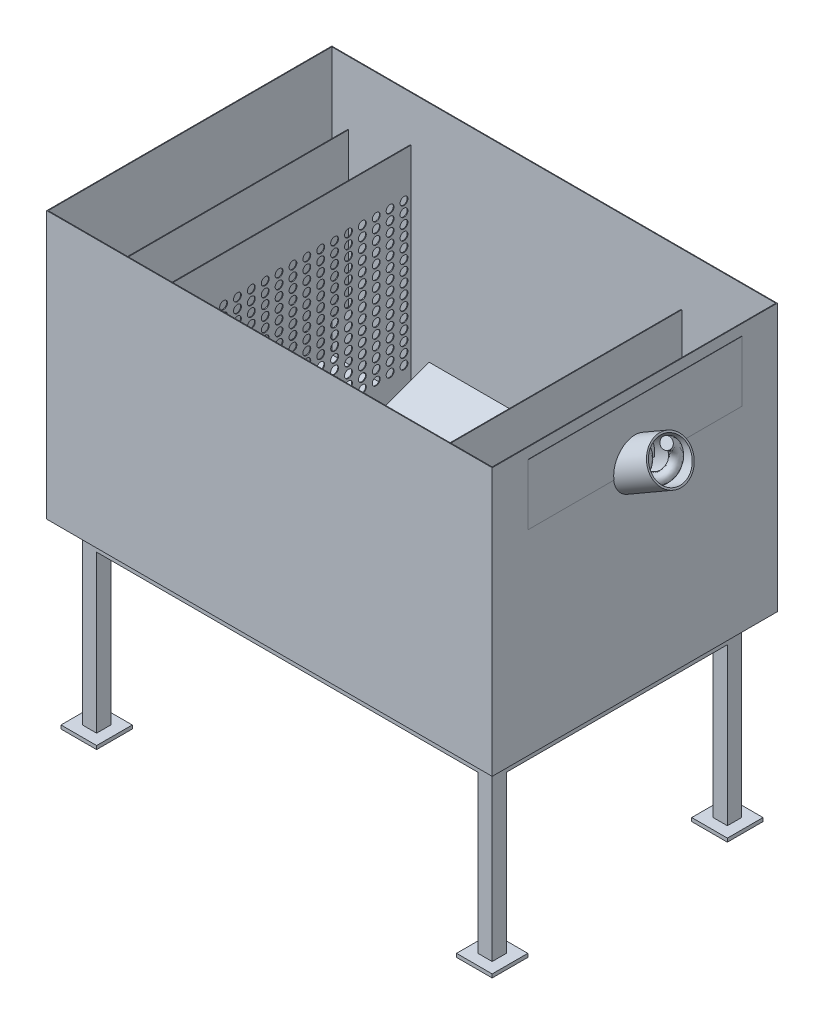
from build123d import *

# Parameters (mm, degrees)
MASTER_FOOTPRINT_W                       = 1250
MASTER_FOOTPRINT_H                       = 800.0000000000001
BATH_BASE_PLATE_DEPTH                    = 750
BATH_SHELL_2MM_T                         = -2
SKETCH_1_R                               = 50.00000000000001
INLET_D100_OPENING_DEPTH                 = 10
INLET_IMPACT_BAFFLE_START                = 125
SKETCH_2_W                               = 640.0000000000001
SKETCH_2_H                               = 430
INLET_IMPACT_BAFFLE_DEPTH                = 2
DISTRIBUTOR_D22_START                    = 250
SKETCH_3_W                               = 740
SKETCH_3_H                               = 648
SKETCH_3_R                               = 11.000000000000004
SKETCH_3_R_2                             = 10.999999999999996
SKETCH_3_R_3                             = 11.00000000000001
DISTRIBUTOR_D22_DEPTH                    = 2
OUTLET_SUBMERGED_BAFFLE_START            = 1030
SKETCH_4_W                               = 700
SKETCH_4_H                               = 330
OUTLET_SUBMERGED_BAFFLE_DEPTH            = 2
OVERFLOW_WEIR_Z550_START                 = 1190
SKETCH_5_W                               = 790.0000000000001
SKETCH_5_H                               = 548
OVERFLOW_WEIR_Z550_DEPTH                 = 2
OUTLET_WEIR_SLOT_W600_START              = 1245
SKETCH_6_W                               = 600
SKETCH_6_H                               = 170
OUTLET_WEIR_SLOT_W600_DEPTH              = 10
SLOPED_SEDIMENT_FLOOR_START              = 275
SLOPED_SEDIMENT_FLOOR_DEPTH              = 725
SKETCH_8_W                               = 39.99999999999999
SKETCH_8_H                               = 39.99999999999999
SKETCH_8_H_2                             = 39.999999999999886
SKETCH_8_W_2                             = 40
FRAME_LEGS_40X40_H500_DEPTH              = 500
FRAME_LONGITUDINAL_RAILS_START           = -20
SKETCH_9_W                               = 1150
SKETCH_9_H                               = 39.99999999999999
SKETCH_9_H_2                             = 39.999999999999886
FRAME_LONGITUDINAL_RAILS_DEPTH           = 40
FRAME_TRANSVERSE_RAILS_START             = -20
SKETCH_10_W                              = 39.99999999999999
SKETCH_10_H                              = 620.0000000000001
SKETCH_10_W_2                            = 40
FRAME_TRANSVERSE_RAILS_DEPTH             = 40
FRAME_FOOT_PADS_100X100_START            = -500
SKETCH_11_W                              = 100.00000000000001
SKETCH_11_H                              = 100.00000000000001
SKETCH_11_H_2                            = 100
SKETCH_11_W_2                            = 100
FRAME_FOOT_PADS_100X100_DEPTH            = 10
SCREW_PASSAGE_D120_PROFILE_R             = 60
SCREW_CASING_ID110_T5_PROFILE_R          = 60
SCREW_CASING_ID110_T5_PROFILE_R_2        = 55
SHAFTLESS_ROUND_COIL_D100_P100_PROFILE_R = 15
CFD_INLET_LID_D100_START                 = 1
SKETCH_12_R                              = 49.999999999999986
CFD_INLET_LID_D100_DEPTH                 = 2
CFD_OUTLET_LID_W600_START                = 1249
SKETCH_13_W                              = 600
SKETCH_13_H                              = 170
CFD_OUTLET_LID_W600_DEPTH                = 2


with BuildPart() as part:
    # MASTER_FOOTPRINT → BATH_BASE_PLATE (new body)
    with BuildSketch(Plane(origin=(0, 0, 0), x_dir=(1, 0, 0), z_dir=(0, 1, 0))):
        with Locations((625, 400.00000000000006)):
            Rectangle(MASTER_FOOTPRINT_W, MASTER_FOOTPRINT_H)
    extrude(amount=BATH_BASE_PLATE_DEPTH)

    # BATH_SHELL_2MM
    bath_shell_2mm_openings = [part.faces().sort_by_distance(p)[0] for p in [
        (625, 750, -400),
    ]]
    offset(amount=BATH_SHELL_2MM_T, openings=bath_shell_2mm_openings, kind=Kind.INTERSECTION)

    # Эскиз1 → INLET_D100_OPENING (cut)
    with BuildSketch(Plane(origin=(0, 0, 0), x_dir=(0, 0, -1), z_dir=(1, 0, 0))):
        with Locations((400, 420)):
            Circle(SKETCH_1_R)
    extrude(amount=INLET_D100_OPENING_DEPTH, mode=Mode.SUBTRACT)

    # Эскиз6 → OUTLET_WEIR_SLOT_W600 (cut)
    with BuildSketch(Plane(origin=(0, 0, 0), x_dir=(0, 0, -1), z_dir=(1, 0, 0)).offset(OUTLET_WEIR_SLOT_W600_START)):
        with Locations((400, 635)):
            Rectangle(SKETCH_6_W, SKETCH_6_H)
    extrude(amount=OUTLET_WEIR_SLOT_W600_DEPTH, mode=Mode.SUBTRACT)

    # Эскиз7 → SLOPED_SEDIMENT_FLOOR (add)
    with BuildSketch(Plane(origin=(0, 0, 0), x_dir=(0, 0, -1), z_dir=(1, 0, 0)).offset(SLOPED_SEDIMENT_FLOOR_START)):
        Polygon((2, -1), (2, 120), (330, -1), align=None)
        Polygon((798, -1), (798, 120), (470.00000000000006, -1), align=None)
    extrude(amount=SLOPED_SEDIMENT_FLOOR_DEPTH)

    # Эскиз8 → FRAME_LEGS_40X40_H500 (add)
    with BuildSketch(Plane(origin=(0, 0, 0), x_dir=(1, 0, 0), z_dir=(0, 1, 0))):
        with Locations((70, 70)):
            Rectangle(SKETCH_8_W, SKETCH_8_H)
        with Locations((70, 730)):
            Rectangle(SKETCH_8_W, SKETCH_8_H_2)
        with Locations((1180, 70)):
            Rectangle(SKETCH_8_W_2, SKETCH_8_H)
        with Locations((1180, 730)):
            Rectangle(SKETCH_8_W_2, SKETCH_8_H_2)
    extrude(amount=-FRAME_LEGS_40X40_H500_DEPTH)

    # Эскиз9 → FRAME_LONGITUDINAL_RAILS (add)
    with BuildSketch(Plane(origin=(0, 0, 0), x_dir=(1, 0, 0), z_dir=(0, 1, 0)).offset(FRAME_LONGITUDINAL_RAILS_START)):
        with Locations((625, 70)):
            Rectangle(SKETCH_9_W, SKETCH_9_H)
        with Locations((625, 730)):
            Rectangle(SKETCH_9_W, SKETCH_9_H_2)
    extrude(amount=-FRAME_LONGITUDINAL_RAILS_DEPTH)

    # Эскиз10 → FRAME_TRANSVERSE_RAILS (add)
    with BuildSketch(Plane(origin=(0, 0, 0), x_dir=(1, 0, 0), z_dir=(0, 1, 0)).offset(FRAME_TRANSVERSE_RAILS_START)):
        with Locations((70, 400.00000000000006)):
            Rectangle(SKETCH_10_W, SKETCH_10_H)
        with Locations((1180, 400.00000000000006)):
            Rectangle(SKETCH_10_W_2, SKETCH_10_H)
    extrude(amount=-FRAME_TRANSVERSE_RAILS_DEPTH)

    # Эскиз11 → FRAME_FOOT_PADS_100X100 (add)
    with BuildSketch(Plane(origin=(0, 0, 0), x_dir=(1, 0, 0), z_dir=(0, 1, 0)).offset(FRAME_FOOT_PADS_100X100_START)):
        with Locations((70, 70)):
            Rectangle(SKETCH_11_W, SKETCH_11_H)
        with Locations((70, 730)):
            Rectangle(SKETCH_11_W, SKETCH_11_H_2)
        with Locations((1180, 70)):
            Rectangle(SKETCH_11_W_2, SKETCH_11_H)
        with Locations((1180, 730)):
            Rectangle(SKETCH_11_W_2, SKETCH_11_H_2)
    extrude(amount=-FRAME_FOOT_PADS_100X100_DEPTH)


with BuildPart() as body_2:
    # Эскиз2 → INLET_IMPACT_BAFFLE (new body)
    with BuildSketch(Plane(origin=(0, 0, 0), x_dir=(0, 0, -1), z_dir=(1, 0, 0)).offset(INLET_IMPACT_BAFFLE_START)):
        with Locations((400.00000000000006, 435)):
            Rectangle(SKETCH_2_W, SKETCH_2_H)
    extrude(amount=INLET_IMPACT_BAFFLE_DEPTH)


with BuildPart() as body_3:
    # Эскиз3 → DISTRIBUTOR_D22 (new body)
    with BuildSketch(Plane(origin=(0, 0, 0), x_dir=(0, 0, -1), z_dir=(1, 0, 0)).offset(DISTRIBUTOR_D22_START)):
        with Locations((400, 326)):
            Rectangle(SKETCH_3_W, SKETCH_3_H)
        with Locations((49.473684210526315, 125)):
            Circle(SKETCH_3_R, mode=Mode.SUBTRACT)
        with Locations((49.473684210526315, 153.5)):
            Circle(SKETCH_3_R, mode=Mode.SUBTRACT)
        with Locations((49.473684210526315, 182)):
            Circle(SKETCH_3_R, mode=Mode.SUBTRACT)
        with Locations((49.473684210526315, 210.50000000000003)):
            Circle(SKETCH_3_R, mode=Mode.SUBTRACT)
        with Locations((49.473684210526315, 239)):
            Circle(SKETCH_3_R, mode=Mode.SUBTRACT)
        with Locations((49.473684210526315, 267.5)):
            Circle(SKETCH_3_R, mode=Mode.SUBTRACT)
        with Locations((49.473684210526315, 296.00000000000006)):
            Circle(SKETCH_3_R, mode=Mode.SUBTRACT)
        with Locations((49.473684210526315, 324.5)):
            Circle(SKETCH_3_R, mode=Mode.SUBTRACT)
        with Locations((49.473684210526315, 353)):
            Circle(SKETCH_3_R, mode=Mode.SUBTRACT)
        with Locations((49.473684210526315, 381.5)):
            Circle(SKETCH_3_R, mode=Mode.SUBTRACT)
        with Locations((49.473684210526315, 410.00000000000006)):
            Circle(SKETCH_3_R, mode=Mode.SUBTRACT)
        with Locations((49.473684210526315, 438.5)):
            Circle(SKETCH_3_R, mode=Mode.SUBTRACT)
        with Locations((49.473684210526315, 467)):
            Circle(SKETCH_3_R, mode=Mode.SUBTRACT)
        with Locations((49.473684210526315, 495.5)):
            Circle(SKETCH_3_R, mode=Mode.SUBTRACT)
        with Locations((49.473684210526315, 524)):
            Circle(SKETCH_3_R, mode=Mode.SUBTRACT)
        with Locations((88.42105263157895, 125)):
            Circle(SKETCH_3_R_2, mode=Mode.SUBTRACT)
        with Locations((88.42105263157895, 153.5)):
            Circle(SKETCH_3_R_2, mode=Mode.SUBTRACT)
        with Locations((88.42105263157895, 182)):
            Circle(SKETCH_3_R_2, mode=Mode.SUBTRACT)
        with Locations((88.42105263157895, 210.50000000000003)):
            Circle(SKETCH_3_R_2, mode=Mode.SUBTRACT)
        with Locations((88.42105263157895, 239)):
            Circle(SKETCH_3_R_2, mode=Mode.SUBTRACT)
        with Locations((88.42105263157895, 267.5)):
            Circle(SKETCH_3_R_2, mode=Mode.SUBTRACT)
        with Locations((88.42105263157895, 296.00000000000006)):
            Circle(SKETCH_3_R_2, mode=Mode.SUBTRACT)
        with Locations((88.42105263157895, 324.5)):
            Circle(SKETCH_3_R_2, mode=Mode.SUBTRACT)
        with Locations((88.42105263157895, 353)):
            Circle(SKETCH_3_R_2, mode=Mode.SUBTRACT)
        with Locations((88.42105263157895, 381.5)):
            Circle(SKETCH_3_R_2, mode=Mode.SUBTRACT)
        with Locations((88.42105263157895, 410.00000000000006)):
            Circle(SKETCH_3_R_2, mode=Mode.SUBTRACT)
        with Locations((88.42105263157895, 438.5)):
            Circle(SKETCH_3_R_2, mode=Mode.SUBTRACT)
        with Locations((88.42105263157895, 467)):
            Circle(SKETCH_3_R_2, mode=Mode.SUBTRACT)
        with Locations((88.42105263157895, 495.5)):
            Circle(SKETCH_3_R_2, mode=Mode.SUBTRACT)
        with Locations((88.42105263157895, 524)):
            Circle(SKETCH_3_R_2, mode=Mode.SUBTRACT)
        with Locations((127.36842105263158, 125)):
            Circle(SKETCH_3_R_3, mode=Mode.SUBTRACT)
        with Locations((127.36842105263158, 153.5)):
            Circle(SKETCH_3_R_3, mode=Mode.SUBTRACT)
        with Locations((127.36842105263158, 182)):
            Circle(SKETCH_3_R_3, mode=Mode.SUBTRACT)
        with Locations((127.36842105263158, 210.50000000000003)):
            Circle(SKETCH_3_R_3, mode=Mode.SUBTRACT)
        with Locations((127.36842105263158, 239)):
            Circle(SKETCH_3_R_3, mode=Mode.SUBTRACT)
        with Locations((127.36842105263158, 267.5)):
            Circle(SKETCH_3_R_3, mode=Mode.SUBTRACT)
        with Locations((127.36842105263158, 296.00000000000006)):
            Circle(SKETCH_3_R_3, mode=Mode.SUBTRACT)
        with Locations((127.36842105263158, 324.5)):
            Circle(SKETCH_3_R_3, mode=Mode.SUBTRACT)
        with Locations((127.36842105263158, 353)):
            Circle(SKETCH_3_R_3, mode=Mode.SUBTRACT)
        with Locations((127.36842105263158, 381.5)):
            Circle(SKETCH_3_R_3, mode=Mode.SUBTRACT)
        with Locations((127.36842105263158, 410.00000000000006)):
            Circle(SKETCH_3_R_3, mode=Mode.SUBTRACT)
        with Locations((127.36842105263158, 438.5)):
            Circle(SKETCH_3_R_3, mode=Mode.SUBTRACT)
        with Locations((127.36842105263158, 467)):
            Circle(SKETCH_3_R_3, mode=Mode.SUBTRACT)
        with Locations((127.36842105263158, 495.5)):
            Circle(SKETCH_3_R_3, mode=Mode.SUBTRACT)
        with Locations((127.36842105263158, 524)):
            Circle(SKETCH_3_R_3, mode=Mode.SUBTRACT)
        with Locations((166.3157894736842, 125)):
            Circle(SKETCH_3_R_3, mode=Mode.SUBTRACT)
        with Locations((166.3157894736842, 153.5)):
            Circle(SKETCH_3_R_3, mode=Mode.SUBTRACT)
        with Locations((166.3157894736842, 182)):
            Circle(SKETCH_3_R_3, mode=Mode.SUBTRACT)
        with Locations((166.3157894736842, 210.50000000000003)):
            Circle(SKETCH_3_R_3, mode=Mode.SUBTRACT)
        with Locations((166.3157894736842, 239)):
            Circle(SKETCH_3_R_3, mode=Mode.SUBTRACT)
        with Locations((166.3157894736842, 267.5)):
            Circle(SKETCH_3_R_3, mode=Mode.SUBTRACT)
        with Locations((166.3157894736842, 296.00000000000006)):
            Circle(SKETCH_3_R_3, mode=Mode.SUBTRACT)
        with Locations((166.3157894736842, 324.5)):
            Circle(SKETCH_3_R_3, mode=Mode.SUBTRACT)
        with Locations((166.3157894736842, 353)):
            Circle(SKETCH_3_R_3, mode=Mode.SUBTRACT)
        with Locations((166.3157894736842, 381.5)):
            Circle(SKETCH_3_R_3, mode=Mode.SUBTRACT)
        with Locations((166.3157894736842, 410.00000000000006)):
            Circle(SKETCH_3_R_3, mode=Mode.SUBTRACT)
        with Locations((166.3157894736842, 438.5)):
            Circle(SKETCH_3_R_3, mode=Mode.SUBTRACT)
        with Locations((166.3157894736842, 467)):
            Circle(SKETCH_3_R_3, mode=Mode.SUBTRACT)
        with Locations((166.3157894736842, 495.5)):
            Circle(SKETCH_3_R_3, mode=Mode.SUBTRACT)
        with Locations((166.3157894736842, 524)):
            Circle(SKETCH_3_R_3, mode=Mode.SUBTRACT)
        with Locations((205.26315789473685, 125)):
            Circle(SKETCH_3_R_3, mode=Mode.SUBTRACT)
        with Locations((205.26315789473685, 153.5)):
            Circle(SKETCH_3_R_3, mode=Mode.SUBTRACT)
        with Locations((205.26315789473685, 182)):
            Circle(SKETCH_3_R_3, mode=Mode.SUBTRACT)
        with Locations((205.26315789473685, 210.50000000000003)):
            Circle(SKETCH_3_R_3, mode=Mode.SUBTRACT)
        with Locations((205.26315789473685, 239)):
            Circle(SKETCH_3_R_3, mode=Mode.SUBTRACT)
        with Locations((205.26315789473685, 267.5)):
            Circle(SKETCH_3_R_3, mode=Mode.SUBTRACT)
        with Locations((205.26315789473685, 296.00000000000006)):
            Circle(SKETCH_3_R_3, mode=Mode.SUBTRACT)
        with Locations((205.26315789473685, 324.5)):
            Circle(SKETCH_3_R_3, mode=Mode.SUBTRACT)
        with Locations((205.26315789473685, 353)):
            Circle(SKETCH_3_R_3, mode=Mode.SUBTRACT)
        with Locations((205.26315789473685, 381.5)):
            Circle(SKETCH_3_R_3, mode=Mode.SUBTRACT)
        with Locations((205.26315789473685, 410.00000000000006)):
            Circle(SKETCH_3_R_3, mode=Mode.SUBTRACT)
        with Locations((205.26315789473685, 438.5)):
            Circle(SKETCH_3_R_3, mode=Mode.SUBTRACT)
        with Locations((205.26315789473685, 467)):
            Circle(SKETCH_3_R_3, mode=Mode.SUBTRACT)
        with Locations((205.26315789473685, 495.5)):
            Circle(SKETCH_3_R_3, mode=Mode.SUBTRACT)
        with Locations((205.26315789473685, 524)):
            Circle(SKETCH_3_R_3, mode=Mode.SUBTRACT)
        with Locations((244.21052631578948, 125)):
            Circle(SKETCH_3_R_3, mode=Mode.SUBTRACT)
        with Locations((244.21052631578948, 153.5)):
            Circle(SKETCH_3_R_3, mode=Mode.SUBTRACT)
        with Locations((244.21052631578948, 182)):
            Circle(SKETCH_3_R_3, mode=Mode.SUBTRACT)
        with Locations((244.21052631578948, 210.50000000000003)):
            Circle(SKETCH_3_R_3, mode=Mode.SUBTRACT)
        with Locations((244.21052631578948, 239)):
            Circle(SKETCH_3_R_3, mode=Mode.SUBTRACT)
        with Locations((244.21052631578948, 267.5)):
            Circle(SKETCH_3_R_3, mode=Mode.SUBTRACT)
        with Locations((244.21052631578948, 296.00000000000006)):
            Circle(SKETCH_3_R_3, mode=Mode.SUBTRACT)
        with Locations((244.21052631578948, 324.5)):
            Circle(SKETCH_3_R_3, mode=Mode.SUBTRACT)
        with Locations((244.21052631578948, 353)):
            Circle(SKETCH_3_R_3, mode=Mode.SUBTRACT)
        with Locations((244.21052631578948, 381.5)):
            Circle(SKETCH_3_R_3, mode=Mode.SUBTRACT)
        with Locations((244.21052631578948, 410.00000000000006)):
            Circle(SKETCH_3_R_3, mode=Mode.SUBTRACT)
        with Locations((244.21052631578948, 438.5)):
            Circle(SKETCH_3_R_3, mode=Mode.SUBTRACT)
        with Locations((244.21052631578948, 467)):
            Circle(SKETCH_3_R_3, mode=Mode.SUBTRACT)
        with Locations((244.21052631578948, 495.5)):
            Circle(SKETCH_3_R_3, mode=Mode.SUBTRACT)
        with Locations((244.21052631578948, 524)):
            Circle(SKETCH_3_R_3, mode=Mode.SUBTRACT)
        with Locations((283.1578947368421, 125)):
            Circle(SKETCH_3_R_3, mode=Mode.SUBTRACT)
        with Locations((283.1578947368421, 153.5)):
            Circle(SKETCH_3_R_3, mode=Mode.SUBTRACT)
        with Locations((283.1578947368421, 182)):
            Circle(SKETCH_3_R_3, mode=Mode.SUBTRACT)
        with Locations((283.1578947368421, 210.50000000000003)):
            Circle(SKETCH_3_R_3, mode=Mode.SUBTRACT)
        with Locations((283.1578947368421, 239)):
            Circle(SKETCH_3_R_3, mode=Mode.SUBTRACT)
        with Locations((283.1578947368421, 267.5)):
            Circle(SKETCH_3_R_3, mode=Mode.SUBTRACT)
        with Locations((283.1578947368421, 296.00000000000006)):
            Circle(SKETCH_3_R_3, mode=Mode.SUBTRACT)
        with Locations((283.1578947368421, 324.5)):
            Circle(SKETCH_3_R_3, mode=Mode.SUBTRACT)
        with Locations((283.1578947368421, 353)):
            Circle(SKETCH_3_R_3, mode=Mode.SUBTRACT)
        with Locations((283.1578947368421, 381.5)):
            Circle(SKETCH_3_R_3, mode=Mode.SUBTRACT)
        with Locations((283.1578947368421, 410.00000000000006)):
            Circle(SKETCH_3_R_3, mode=Mode.SUBTRACT)
        with Locations((283.1578947368421, 438.5)):
            Circle(SKETCH_3_R_3, mode=Mode.SUBTRACT)
        with Locations((283.1578947368421, 467)):
            Circle(SKETCH_3_R_3, mode=Mode.SUBTRACT)
        with Locations((283.1578947368421, 495.5)):
            Circle(SKETCH_3_R_3, mode=Mode.SUBTRACT)
        with Locations((283.1578947368421, 524)):
            Circle(SKETCH_3_R_3, mode=Mode.SUBTRACT)
        with Locations((322.1052631578947, 125)):
            Circle(SKETCH_3_R_3, mode=Mode.SUBTRACT)
        with Locations((322.1052631578947, 153.5)):
            Circle(SKETCH_3_R_3, mode=Mode.SUBTRACT)
        with Locations((322.1052631578947, 182)):
            Circle(SKETCH_3_R_3, mode=Mode.SUBTRACT)
        with Locations((322.1052631578947, 210.50000000000003)):
            Circle(SKETCH_3_R_3, mode=Mode.SUBTRACT)
        with Locations((322.1052631578947, 239)):
            Circle(SKETCH_3_R_3, mode=Mode.SUBTRACT)
        with Locations((322.1052631578947, 267.5)):
            Circle(SKETCH_3_R_3, mode=Mode.SUBTRACT)
        with Locations((322.1052631578947, 296.00000000000006)):
            Circle(SKETCH_3_R_3, mode=Mode.SUBTRACT)
        with Locations((322.1052631578947, 324.5)):
            Circle(SKETCH_3_R_3, mode=Mode.SUBTRACT)
        with Locations((322.1052631578947, 353)):
            Circle(SKETCH_3_R_3, mode=Mode.SUBTRACT)
        with Locations((322.1052631578947, 381.5)):
            Circle(SKETCH_3_R_3, mode=Mode.SUBTRACT)
        with Locations((322.1052631578947, 410.00000000000006)):
            Circle(SKETCH_3_R_3, mode=Mode.SUBTRACT)
        with Locations((322.1052631578947, 438.5)):
            Circle(SKETCH_3_R_3, mode=Mode.SUBTRACT)
        with Locations((322.1052631578947, 467)):
            Circle(SKETCH_3_R_3, mode=Mode.SUBTRACT)
        with Locations((322.1052631578947, 495.5)):
            Circle(SKETCH_3_R_3, mode=Mode.SUBTRACT)
        with Locations((322.1052631578947, 524)):
            Circle(SKETCH_3_R_3, mode=Mode.SUBTRACT)
        with Locations((361.0526315789474, 125)):
            Circle(SKETCH_3_R_3, mode=Mode.SUBTRACT)
        with Locations((361.0526315789474, 153.5)):
            Circle(SKETCH_3_R_3, mode=Mode.SUBTRACT)
        with Locations((361.0526315789474, 182)):
            Circle(SKETCH_3_R_3, mode=Mode.SUBTRACT)
        with Locations((361.0526315789474, 210.50000000000003)):
            Circle(SKETCH_3_R_3, mode=Mode.SUBTRACT)
        with Locations((361.0526315789474, 239)):
            Circle(SKETCH_3_R_3, mode=Mode.SUBTRACT)
        with Locations((361.0526315789474, 267.5)):
            Circle(SKETCH_3_R_3, mode=Mode.SUBTRACT)
        with Locations((361.0526315789474, 296.00000000000006)):
            Circle(SKETCH_3_R_3, mode=Mode.SUBTRACT)
        with Locations((361.0526315789474, 324.5)):
            Circle(SKETCH_3_R_3, mode=Mode.SUBTRACT)
        with Locations((361.0526315789474, 353)):
            Circle(SKETCH_3_R_3, mode=Mode.SUBTRACT)
        with Locations((361.0526315789474, 381.5)):
            Circle(SKETCH_3_R_3, mode=Mode.SUBTRACT)
        with Locations((361.0526315789474, 410.00000000000006)):
            Circle(SKETCH_3_R_3, mode=Mode.SUBTRACT)
        with Locations((361.0526315789474, 438.5)):
            Circle(SKETCH_3_R_3, mode=Mode.SUBTRACT)
        with Locations((361.0526315789474, 467)):
            Circle(SKETCH_3_R_3, mode=Mode.SUBTRACT)
        with Locations((361.0526315789474, 495.5)):
            Circle(SKETCH_3_R_3, mode=Mode.SUBTRACT)
        with Locations((361.0526315789474, 524)):
            Circle(SKETCH_3_R_3, mode=Mode.SUBTRACT)
        with Locations((400, 125)):
            Circle(SKETCH_3_R_3, mode=Mode.SUBTRACT)
        with Locations((400, 153.5)):
            Circle(SKETCH_3_R_3, mode=Mode.SUBTRACT)
        with Locations((400, 182)):
            Circle(SKETCH_3_R_3, mode=Mode.SUBTRACT)
        with Locations((400, 210.50000000000003)):
            Circle(SKETCH_3_R_3, mode=Mode.SUBTRACT)
        with Locations((400, 239)):
            Circle(SKETCH_3_R_3, mode=Mode.SUBTRACT)
        with Locations((400, 267.5)):
            Circle(SKETCH_3_R_3, mode=Mode.SUBTRACT)
        with Locations((400, 296.00000000000006)):
            Circle(SKETCH_3_R_3, mode=Mode.SUBTRACT)
        with Locations((400, 324.5)):
            Circle(SKETCH_3_R_3, mode=Mode.SUBTRACT)
        with Locations((400, 353)):
            Circle(SKETCH_3_R_3, mode=Mode.SUBTRACT)
        with Locations((400, 381.5)):
            Circle(SKETCH_3_R_3, mode=Mode.SUBTRACT)
        with Locations((400, 410.00000000000006)):
            Circle(SKETCH_3_R_3, mode=Mode.SUBTRACT)
        with Locations((400, 438.5)):
            Circle(SKETCH_3_R_3, mode=Mode.SUBTRACT)
        with Locations((400, 467)):
            Circle(SKETCH_3_R_3, mode=Mode.SUBTRACT)
        with Locations((400, 495.5)):
            Circle(SKETCH_3_R_3, mode=Mode.SUBTRACT)
        with Locations((400, 524)):
            Circle(SKETCH_3_R_3, mode=Mode.SUBTRACT)
        with Locations((438.94736842105266, 125)):
            Circle(SKETCH_3_R_3, mode=Mode.SUBTRACT)
        with Locations((438.94736842105266, 153.5)):
            Circle(SKETCH_3_R_3, mode=Mode.SUBTRACT)
        with Locations((438.94736842105266, 182)):
            Circle(SKETCH_3_R_3, mode=Mode.SUBTRACT)
        with Locations((438.94736842105266, 210.50000000000003)):
            Circle(SKETCH_3_R_3, mode=Mode.SUBTRACT)
        with Locations((438.94736842105266, 239)):
            Circle(SKETCH_3_R_3, mode=Mode.SUBTRACT)
        with Locations((438.94736842105266, 267.5)):
            Circle(SKETCH_3_R_3, mode=Mode.SUBTRACT)
        with Locations((438.94736842105266, 296.00000000000006)):
            Circle(SKETCH_3_R_3, mode=Mode.SUBTRACT)
        with Locations((438.94736842105266, 324.5)):
            Circle(SKETCH_3_R_3, mode=Mode.SUBTRACT)
        with Locations((438.94736842105266, 353)):
            Circle(SKETCH_3_R_3, mode=Mode.SUBTRACT)
        with Locations((438.94736842105266, 381.5)):
            Circle(SKETCH_3_R_3, mode=Mode.SUBTRACT)
        with Locations((438.94736842105266, 410.00000000000006)):
            Circle(SKETCH_3_R_3, mode=Mode.SUBTRACT)
        with Locations((438.94736842105266, 438.5)):
            Circle(SKETCH_3_R_3, mode=Mode.SUBTRACT)
        with Locations((438.94736842105266, 467)):
            Circle(SKETCH_3_R_3, mode=Mode.SUBTRACT)
        with Locations((438.94736842105266, 495.5)):
            Circle(SKETCH_3_R_3, mode=Mode.SUBTRACT)
        with Locations((438.94736842105266, 524)):
            Circle(SKETCH_3_R_3, mode=Mode.SUBTRACT)
        with Locations((477.89473684210526, 125)):
            Circle(SKETCH_3_R_3, mode=Mode.SUBTRACT)
        with Locations((477.89473684210526, 153.5)):
            Circle(SKETCH_3_R_3, mode=Mode.SUBTRACT)
        with Locations((477.89473684210526, 182)):
            Circle(SKETCH_3_R_3, mode=Mode.SUBTRACT)
        with Locations((477.89473684210526, 210.50000000000003)):
            Circle(SKETCH_3_R_3, mode=Mode.SUBTRACT)
        with Locations((477.89473684210526, 239)):
            Circle(SKETCH_3_R_3, mode=Mode.SUBTRACT)
        with Locations((477.89473684210526, 267.5)):
            Circle(SKETCH_3_R_3, mode=Mode.SUBTRACT)
        with Locations((477.89473684210526, 296.00000000000006)):
            Circle(SKETCH_3_R_3, mode=Mode.SUBTRACT)
        with Locations((477.89473684210526, 324.5)):
            Circle(SKETCH_3_R_3, mode=Mode.SUBTRACT)
        with Locations((477.89473684210526, 353)):
            Circle(SKETCH_3_R_3, mode=Mode.SUBTRACT)
        with Locations((477.89473684210526, 381.5)):
            Circle(SKETCH_3_R_3, mode=Mode.SUBTRACT)
        with Locations((477.89473684210526, 410.00000000000006)):
            Circle(SKETCH_3_R_3, mode=Mode.SUBTRACT)
        with Locations((477.89473684210526, 438.5)):
            Circle(SKETCH_3_R_3, mode=Mode.SUBTRACT)
        with Locations((477.89473684210526, 467)):
            Circle(SKETCH_3_R_3, mode=Mode.SUBTRACT)
        with Locations((477.89473684210526, 495.5)):
            Circle(SKETCH_3_R_3, mode=Mode.SUBTRACT)
        with Locations((477.89473684210526, 524)):
            Circle(SKETCH_3_R_3, mode=Mode.SUBTRACT)
        with Locations((516.8421052631579, 125)):
            Circle(SKETCH_3_R_3, mode=Mode.SUBTRACT)
        with Locations((516.8421052631579, 153.5)):
            Circle(SKETCH_3_R_3, mode=Mode.SUBTRACT)
        with Locations((516.8421052631579, 182)):
            Circle(SKETCH_3_R_3, mode=Mode.SUBTRACT)
        with Locations((516.8421052631579, 210.50000000000003)):
            Circle(SKETCH_3_R_3, mode=Mode.SUBTRACT)
        with Locations((516.8421052631579, 239)):
            Circle(SKETCH_3_R_3, mode=Mode.SUBTRACT)
        with Locations((516.8421052631579, 267.5)):
            Circle(SKETCH_3_R_3, mode=Mode.SUBTRACT)
        with Locations((516.8421052631579, 296.00000000000006)):
            Circle(SKETCH_3_R_3, mode=Mode.SUBTRACT)
        with Locations((516.8421052631579, 324.5)):
            Circle(SKETCH_3_R_3, mode=Mode.SUBTRACT)
        with Locations((516.8421052631579, 353)):
            Circle(SKETCH_3_R_3, mode=Mode.SUBTRACT)
        with Locations((516.8421052631579, 381.5)):
            Circle(SKETCH_3_R_3, mode=Mode.SUBTRACT)
        with Locations((516.8421052631579, 410.00000000000006)):
            Circle(SKETCH_3_R_3, mode=Mode.SUBTRACT)
        with Locations((516.8421052631579, 438.5)):
            Circle(SKETCH_3_R_3, mode=Mode.SUBTRACT)
        with Locations((516.8421052631579, 467)):
            Circle(SKETCH_3_R_3, mode=Mode.SUBTRACT)
        with Locations((516.8421052631579, 495.5)):
            Circle(SKETCH_3_R_3, mode=Mode.SUBTRACT)
        with Locations((516.8421052631579, 524)):
            Circle(SKETCH_3_R_3, mode=Mode.SUBTRACT)
        with Locations((555.7894736842106, 125)):
            Circle(SKETCH_3_R_3, mode=Mode.SUBTRACT)
        with Locations((555.7894736842106, 153.5)):
            Circle(SKETCH_3_R_3, mode=Mode.SUBTRACT)
        with Locations((555.7894736842106, 182)):
            Circle(SKETCH_3_R_3, mode=Mode.SUBTRACT)
        with Locations((555.7894736842106, 210.50000000000003)):
            Circle(SKETCH_3_R_3, mode=Mode.SUBTRACT)
        with Locations((555.7894736842106, 239)):
            Circle(SKETCH_3_R_3, mode=Mode.SUBTRACT)
        with Locations((555.7894736842106, 267.5)):
            Circle(SKETCH_3_R_3, mode=Mode.SUBTRACT)
        with Locations((555.7894736842106, 296.00000000000006)):
            Circle(SKETCH_3_R_3, mode=Mode.SUBTRACT)
        with Locations((555.7894736842106, 324.5)):
            Circle(SKETCH_3_R_3, mode=Mode.SUBTRACT)
        with Locations((555.7894736842106, 353)):
            Circle(SKETCH_3_R_3, mode=Mode.SUBTRACT)
        with Locations((555.7894736842106, 381.5)):
            Circle(SKETCH_3_R_3, mode=Mode.SUBTRACT)
        with Locations((555.7894736842106, 410.00000000000006)):
            Circle(SKETCH_3_R_3, mode=Mode.SUBTRACT)
        with Locations((555.7894736842106, 438.5)):
            Circle(SKETCH_3_R_3, mode=Mode.SUBTRACT)
        with Locations((555.7894736842106, 467)):
            Circle(SKETCH_3_R_3, mode=Mode.SUBTRACT)
        with Locations((555.7894736842106, 495.5)):
            Circle(SKETCH_3_R_3, mode=Mode.SUBTRACT)
        with Locations((555.7894736842106, 524)):
            Circle(SKETCH_3_R_3, mode=Mode.SUBTRACT)
        with Locations((594.7368421052632, 125)):
            Circle(SKETCH_3_R_3, mode=Mode.SUBTRACT)
        with Locations((594.7368421052632, 153.5)):
            Circle(SKETCH_3_R_3, mode=Mode.SUBTRACT)
        with Locations((594.7368421052632, 182)):
            Circle(SKETCH_3_R_3, mode=Mode.SUBTRACT)
        with Locations((594.7368421052632, 210.50000000000003)):
            Circle(SKETCH_3_R_3, mode=Mode.SUBTRACT)
        with Locations((594.7368421052632, 239)):
            Circle(SKETCH_3_R_3, mode=Mode.SUBTRACT)
        with Locations((594.7368421052632, 267.5)):
            Circle(SKETCH_3_R_3, mode=Mode.SUBTRACT)
        with Locations((594.7368421052632, 296.00000000000006)):
            Circle(SKETCH_3_R_3, mode=Mode.SUBTRACT)
        with Locations((594.7368421052632, 324.5)):
            Circle(SKETCH_3_R_3, mode=Mode.SUBTRACT)
        with Locations((594.7368421052632, 353)):
            Circle(SKETCH_3_R_3, mode=Mode.SUBTRACT)
        with Locations((594.7368421052632, 381.5)):
            Circle(SKETCH_3_R_3, mode=Mode.SUBTRACT)
        with Locations((594.7368421052632, 410.00000000000006)):
            Circle(SKETCH_3_R_3, mode=Mode.SUBTRACT)
        with Locations((594.7368421052632, 438.5)):
            Circle(SKETCH_3_R_3, mode=Mode.SUBTRACT)
        with Locations((594.7368421052632, 467)):
            Circle(SKETCH_3_R_3, mode=Mode.SUBTRACT)
        with Locations((594.7368421052632, 495.5)):
            Circle(SKETCH_3_R_3, mode=Mode.SUBTRACT)
        with Locations((594.7368421052632, 524)):
            Circle(SKETCH_3_R_3, mode=Mode.SUBTRACT)
        with Locations((633.6842105263158, 125)):
            Circle(SKETCH_3_R_3, mode=Mode.SUBTRACT)
        with Locations((633.6842105263158, 153.5)):
            Circle(SKETCH_3_R_3, mode=Mode.SUBTRACT)
        with Locations((633.6842105263158, 182)):
            Circle(SKETCH_3_R_3, mode=Mode.SUBTRACT)
        with Locations((633.6842105263158, 210.50000000000003)):
            Circle(SKETCH_3_R_3, mode=Mode.SUBTRACT)
        with Locations((633.6842105263158, 239)):
            Circle(SKETCH_3_R_3, mode=Mode.SUBTRACT)
        with Locations((633.6842105263158, 267.5)):
            Circle(SKETCH_3_R_3, mode=Mode.SUBTRACT)
        with Locations((633.6842105263158, 296.00000000000006)):
            Circle(SKETCH_3_R_3, mode=Mode.SUBTRACT)
        with Locations((633.6842105263158, 324.5)):
            Circle(SKETCH_3_R_3, mode=Mode.SUBTRACT)
        with Locations((633.6842105263158, 353)):
            Circle(SKETCH_3_R_3, mode=Mode.SUBTRACT)
        with Locations((633.6842105263158, 381.5)):
            Circle(SKETCH_3_R_3, mode=Mode.SUBTRACT)
        with Locations((633.6842105263158, 410.00000000000006)):
            Circle(SKETCH_3_R_3, mode=Mode.SUBTRACT)
        with Locations((633.6842105263158, 438.5)):
            Circle(SKETCH_3_R_3, mode=Mode.SUBTRACT)
        with Locations((633.6842105263158, 467)):
            Circle(SKETCH_3_R_3, mode=Mode.SUBTRACT)
        with Locations((633.6842105263158, 495.5)):
            Circle(SKETCH_3_R_3, mode=Mode.SUBTRACT)
        with Locations((633.6842105263158, 524)):
            Circle(SKETCH_3_R_3, mode=Mode.SUBTRACT)
        with Locations((672.6315789473683, 125)):
            Circle(SKETCH_3_R_3, mode=Mode.SUBTRACT)
        with Locations((672.6315789473683, 153.5)):
            Circle(SKETCH_3_R_3, mode=Mode.SUBTRACT)
        with Locations((672.6315789473683, 182)):
            Circle(SKETCH_3_R_3, mode=Mode.SUBTRACT)
        with Locations((672.6315789473683, 210.50000000000003)):
            Circle(SKETCH_3_R_3, mode=Mode.SUBTRACT)
        with Locations((672.6315789473683, 239)):
            Circle(SKETCH_3_R_3, mode=Mode.SUBTRACT)
        with Locations((672.6315789473683, 267.5)):
            Circle(SKETCH_3_R_3, mode=Mode.SUBTRACT)
        with Locations((672.6315789473683, 296.00000000000006)):
            Circle(SKETCH_3_R_3, mode=Mode.SUBTRACT)
        with Locations((672.6315789473683, 324.5)):
            Circle(SKETCH_3_R_3, mode=Mode.SUBTRACT)
        with Locations((672.6315789473683, 353)):
            Circle(SKETCH_3_R_3, mode=Mode.SUBTRACT)
        with Locations((672.6315789473683, 381.5)):
            Circle(SKETCH_3_R_3, mode=Mode.SUBTRACT)
        with Locations((672.6315789473683, 410.00000000000006)):
            Circle(SKETCH_3_R_3, mode=Mode.SUBTRACT)
        with Locations((672.6315789473683, 438.5)):
            Circle(SKETCH_3_R_3, mode=Mode.SUBTRACT)
        with Locations((672.6315789473683, 467)):
            Circle(SKETCH_3_R_3, mode=Mode.SUBTRACT)
        with Locations((672.6315789473683, 495.5)):
            Circle(SKETCH_3_R_3, mode=Mode.SUBTRACT)
        with Locations((672.6315789473683, 524)):
            Circle(SKETCH_3_R_3, mode=Mode.SUBTRACT)
        with Locations((711.578947368421, 125)):
            Circle(SKETCH_3_R_3, mode=Mode.SUBTRACT)
        with Locations((711.578947368421, 153.5)):
            Circle(SKETCH_3_R_3, mode=Mode.SUBTRACT)
        with Locations((711.578947368421, 182)):
            Circle(SKETCH_3_R_3, mode=Mode.SUBTRACT)
        with Locations((711.578947368421, 210.50000000000003)):
            Circle(SKETCH_3_R_3, mode=Mode.SUBTRACT)
        with Locations((711.578947368421, 239)):
            Circle(SKETCH_3_R_3, mode=Mode.SUBTRACT)
        with Locations((711.578947368421, 267.5)):
            Circle(SKETCH_3_R_3, mode=Mode.SUBTRACT)
        with Locations((711.578947368421, 296.00000000000006)):
            Circle(SKETCH_3_R_3, mode=Mode.SUBTRACT)
        with Locations((711.578947368421, 324.5)):
            Circle(SKETCH_3_R_3, mode=Mode.SUBTRACT)
        with Locations((711.578947368421, 353)):
            Circle(SKETCH_3_R_3, mode=Mode.SUBTRACT)
        with Locations((711.578947368421, 381.5)):
            Circle(SKETCH_3_R_3, mode=Mode.SUBTRACT)
        with Locations((711.578947368421, 410.00000000000006)):
            Circle(SKETCH_3_R_3, mode=Mode.SUBTRACT)
        with Locations((711.578947368421, 438.5)):
            Circle(SKETCH_3_R_3, mode=Mode.SUBTRACT)
        with Locations((711.578947368421, 467)):
            Circle(SKETCH_3_R_3, mode=Mode.SUBTRACT)
        with Locations((711.578947368421, 495.5)):
            Circle(SKETCH_3_R_3, mode=Mode.SUBTRACT)
        with Locations((711.578947368421, 524)):
            Circle(SKETCH_3_R_3, mode=Mode.SUBTRACT)
        with Locations((750.5263157894738, 125)):
            Circle(SKETCH_3_R_3, mode=Mode.SUBTRACT)
        with Locations((750.5263157894738, 153.5)):
            Circle(SKETCH_3_R_3, mode=Mode.SUBTRACT)
        with Locations((750.5263157894738, 182)):
            Circle(SKETCH_3_R_3, mode=Mode.SUBTRACT)
        with Locations((750.5263157894738, 210.50000000000003)):
            Circle(SKETCH_3_R_3, mode=Mode.SUBTRACT)
        with Locations((750.5263157894738, 239)):
            Circle(SKETCH_3_R_3, mode=Mode.SUBTRACT)
        with Locations((750.5263157894738, 267.5)):
            Circle(SKETCH_3_R_3, mode=Mode.SUBTRACT)
        with Locations((750.5263157894738, 296.00000000000006)):
            Circle(SKETCH_3_R_3, mode=Mode.SUBTRACT)
        with Locations((750.5263157894738, 324.5)):
            Circle(SKETCH_3_R_3, mode=Mode.SUBTRACT)
        with Locations((750.5263157894738, 353)):
            Circle(SKETCH_3_R_3, mode=Mode.SUBTRACT)
        with Locations((750.5263157894738, 381.5)):
            Circle(SKETCH_3_R_3, mode=Mode.SUBTRACT)
        with Locations((750.5263157894738, 410.00000000000006)):
            Circle(SKETCH_3_R_3, mode=Mode.SUBTRACT)
        with Locations((750.5263157894738, 438.5)):
            Circle(SKETCH_3_R_3, mode=Mode.SUBTRACT)
        with Locations((750.5263157894738, 467)):
            Circle(SKETCH_3_R_3, mode=Mode.SUBTRACT)
        with Locations((750.5263157894738, 495.5)):
            Circle(SKETCH_3_R_3, mode=Mode.SUBTRACT)
        with Locations((750.5263157894738, 524)):
            Circle(SKETCH_3_R_3, mode=Mode.SUBTRACT)
    extrude(amount=DISTRIBUTOR_D22_DEPTH)


with BuildPart() as body_4:
    # Эскиз4 → OUTLET_SUBMERGED_BAFFLE (new body)
    with BuildSketch(Plane(origin=(0, 0, 0), x_dir=(0, 0, -1), z_dir=(1, 0, 0)).offset(OUTLET_SUBMERGED_BAFFLE_START)):
        with Locations((400, 485)):
            Rectangle(SKETCH_4_W, SKETCH_4_H)
    extrude(amount=OUTLET_SUBMERGED_BAFFLE_DEPTH)


with BuildPart() as body_5:
    # Эскиз5 → OVERFLOW_WEIR_Z550 (new body)
    with BuildSketch(Plane(origin=(0, 0, 0), x_dir=(0, 0, -1), z_dir=(1, 0, 0)).offset(OVERFLOW_WEIR_Z550_START)):
        with Locations((400.00000000000006, 276)):
            Rectangle(SKETCH_5_W, SKETCH_5_H)
    extrude(amount=OVERFLOW_WEIR_Z550_DEPTH)


with BuildPart() as screw_passage_d120_tool:
    # SCREW_PASSAGE_D120: sweep along a curve in space
    with BuildLine() as screw_passage_d120_path:
        Line((400, 70, -400), (1350, 618.4827557301444, -400))
    # SCREW_PASSAGE_D120 profile (on start of the path) → SCREW_PASSAGE_D120 (sweep)
    with BuildSketch(Plane(origin=(400, 70, -400), x_dir=(-0.49999999999999994, 0.8660254037844387, 0), z_dir=(0.8660254037844387, 0.49999999999999994, 0))):
        Circle(SCREW_PASSAGE_D120_PROFILE_R)
    sweep(path=screw_passage_d120_path.line)


with BuildPart() as part_1:
    add(part.part)

    # SCREW_PASSAGE_D120: cut by screw_passage_d120_tool
    add(screw_passage_d120_tool.part, mode=Mode.SUBTRACT)


with BuildPart() as body_4_1:
    add(body_4.part)

    # SCREW_PASSAGE_D120: cut by screw_passage_d120_tool
    add(screw_passage_d120_tool.part, mode=Mode.SUBTRACT)


with BuildPart() as body_5_1:
    add(body_5.part)

    # SCREW_PASSAGE_D120: cut by screw_passage_d120_tool
    add(screw_passage_d120_tool.part, mode=Mode.SUBTRACT)


with BuildPart() as body_6:
    # SCREW_CASING_ID110_T5: sweep along a curve in space
    with BuildLine() as screw_casing_id110_t5_path:
        Line((400, 70, -400), (1350, 618.4827557301444, -400))
    # SCREW_CASING_ID110_T5 profile (on start of the path) → SCREW_CASING_ID110_T5 (sweep)
    with BuildSketch(Plane(origin=(400, 70, -400), x_dir=(-0.49999999999999994, 0.8660254037844387, 0), z_dir=(0.8660254037844387, 0.49999999999999994, 0))):
        Circle(SCREW_CASING_ID110_T5_PROFILE_R)
        Circle(SCREW_CASING_ID110_T5_PROFILE_R_2, mode=Mode.SUBTRACT)
    sweep(path=screw_casing_id110_t5_path.line)


with BuildPart() as body_7:
    # SHAFTLESS_ROUND_COIL_D100_P100: sweep along a curve in space
    with BuildLine() as shaftless_round_coil_d100_p100_path:
        add(Edge.make_bspline(
            [(382.5, 100.31088913245537, -400), (384.56081325221146, 100.89662826660874, -395.4317573269976), (388.68243975663466, 102.06810653491554, -386.29527198099305), (398.10578132878413, 98.21191733056162, -374.66561643643087), (409.26026125756846, 91.35730853758504, -366.87191312068217), (421.5154498435194, 82.59621642606517, -364.0942291756902), (433.7684051900171, 73.83899239874322, -366.75314175475296), (444.9984759946948, 66.85345636813098, -374.44605722032355), (454.3179297660776, 63.17720611299152, -386.00816901011905), (461.13420998056347, 63.836579638560636, -399.68882436487394), (465.23219626469637, 69.20417636140702, -413.4165957218052), (466.8087754311218, 78.938978318689, -425.1129215480801), (466.44249463654126, 92.03891244042406, -433.00682734930655), (465.00610540929233, 106.99232873714895, -435.9030740356413), (463.53437936101386, 122.00695020327488, -433.3631325264868), (463.06744073115374, 135.28122880989434, -425.77158270588313), (464.4932754089262, 145.27712788048387, -414.2778830708727), (468.4132791634858, 150.9529993874111, -400.6223278986629), (475.0511983743161, 151.9213032334005, -386.8725442608599), (484.21925199842923, 148.5072857256058, -375.11042663335695), (495.3465640265167, 141.6997331169708, -367.1169112373005), (507.5656014730995, 133.00125661558832, -364.1023193391473), (519.8435300519066, 124.20077768107744, -366.52309901002013), (531.1385986002066, 117.10266225613358, -374.0127130041777), (540.5578736328245, 113.2535165048598, -385.437137222642), (547.492440981625, 113.70801070391364, -399.0665665792237), (551.7096032493997, 118.8691885680509, -412.8373297875604), (553.3881131952447, 128.42744123652258, -424.6643557943567), (553.091108262734, 141.4073860454152, -432.75688041317903), (551.6808443121829, 156.31555203553742, -435.88959110502697), (550.1881389690195, 171.366510706311, -433.58815509087395), (549.6562925481734, 184.7532129047254, -426.2010394485085), (550.983118938374, 194.92059935975985, -414.84674870525504), (554.7850050066796, 200.80105670055104, -401.2444688351437), (561.3035816816497, 201.9760678821547, -387.4537603423313), (570.3691379161644, 198.73958106078734, -375.5627142532757), (581.4263171275162, 192.05350205401697, -367.3717882200754), (593.6182053425127, 183.40204940112778, -364.1211940242512), (605.9160790185416, 174.5670245448667, -366.303113526836), (617.2751670480504, 167.35802412579554, -373.58717599044707), (626.7928425712076, 163.33844372541782, -384.8704804673668), (633.8452923172393, 163.5887596231497, -398.4445892192931), (638.1819699745048, 168.5429307604017, -412.25420721248423), (639.9635321315932, 177.92269176316816, -424.20838027838454), (639.7375127989636, 190.77968590646032, -432.49709252690104), (638.3554197021144, 205.63905854667897, -435.86532608306146), (636.8438050361032, 220.72276912536157, -433.80308697031995), (636.2488322310778, 234.21880942847199, -426.62262477237067), (637.477873324025, 244.55556498658297, -415.41115402131436), (641.162121136448, 250.63977776347696, -401.86623590342913), (647.5610185451898, 252.02207951479977, -388.0387456141986), (656.5229754866912, 248.96503193256098, -376.02234341817115), (667.5083216465875, 242.4033714205729, -367.6364674978669), (679.6710195015987, 233.8024779542702, -364.1508475605957), (691.9867653058735, 224.93649766384797, -366.09325139410015), (703.4080818812731, 217.61971424161246, -373.169574020626), (713.0229201639999, 213.43184300505627, -384.30836898153257), (720.1927551890642, 213.4788416354431, -397.82307914195343), (724.6492670004975, 218.2254539291952, -411.6674031805417), (726.5349677512984, 227.4248415966228, -423.74513198611197), (726.3816235265039, 240.1559587606984, -432.22754173696535), (725.0297381035127, 254.96301017501676, -435.83028625953773), (723.5012898461861, 270.0758773891304, -434.00786359414894), (722.844991007382, 283.67813749857396, -427.0362120231574), (723.9774991760839, 294.1820929860798, -415.97092945819776), (727.5446235028267, 300.4691695909323, -402.48744230982436), (733.8235408698921, 302.05928287033294, -388.6273243328979), (742.6808277385596, 299.18352917227355, -376.4891760444516), (753.592662192678, 292.74919466964474, -367.91086955469086), (765.7241373287779, 284.20238053884583, -364.191271039549), (778.0556769231098, 275.30904460160116, -365.89357565941543), (789.5374124141395, 267.8876125477562, -372.76003255233167), (799.2481465354499, 263.53364484653866, -383.75097163687064), (806.534834456004, 263.37824832492606, -397.20222306369374), (811.111463185235, 267.91681201420306, -411.0770939816959), (813.1023576264944, 276.93399886512105, -423.2747500884029), (813.0233561841491, 289.536350552819, -431.94830902287504), (811.7037061800646, 304.28756858378733, -435.7844821612567), (810.16050512017, 319.4259884015038, -434.2024234425666), (809.4446990217916, 333.1313181079476, -427.4416769493693), (810.4819556400572, 343.80025412030983, -416.5259068459793), (813.9325064380171, 350.2892419998317, -403.10790142907024), (820.0911790328307, 352.0876253341165, -389.2193196753081), (828.8427564942381, 349.3949657002699, -376.9630718844333), (839.6794226729291, 343.09082646979874, -368.1949119536079), (851.7776521112445, 334.6015955766965, -364.2424523169318), (864.122902412612, 325.6845119982578, -365.70414631014694), (875.6632290377235, 318.16159712331, -372.35867462161394), (885.4685632672289, 313.64377722829755, -383.19845588887205), (892.8715365943252, 313.28696847437385, -396.5822075045254), (897.5685289189911, 317.61705630097754, -410.48345695894517), (899.6656405447548, 326.4502695916965, -422.7973758992273), (899.6626272251231, 338.9210059900835, -431.6594782728139), (898.3772307007034, 353.6128952539355, -435.72792754886456), (896.8213620590809, 368.7732559668141, -434.386708065142), (896.0478853527395, 382.5784740963531, -427.838897739647), (896.9912004102194, 393.4101216649389, -417.0759194561804), (900.3257626577692, 400.1000076068659, -403.7274268604118), (906.3639618741619, 402.1070569535372, -389.81455379187287), (915.0088223515152, 399.59923655810127, -377.4438885684743), (925.7686862674772, 393.42812274881413, -368.4885093614898), (937.8316570169361, 384.99996169621835, -364.304376016664), (950.1885308232947, 376.062745616574, -365.5250202554011), (961.785603198762, 368.44154421889573, -371.9656208059925), (971.6842133859387, 363.7621656260719, -382.6509877264785), (979.2028696957144, 363.2049880685774, -395.963218731948), (984.0204361333482, 367.3262354054416, -409.886670455046), (986.2247565274806, 375.9737576623301, -422.3131528332062), (986.2993538421769, 388.3100684988524, -431.36113625844604), (985.0502185676165, 402.939151435603, -435.6606394127194), (983.4837713707515, 418.11783474363165, -434.56066209836837), (982.6544780336864, 432.01973011349185, -428.2277550593666), (983.5051897423228, 443.0117713872255, -417.62080205186214), (986.7243832635705, 449.9014818247119, -404.3458324835947), (992.6419166884549, 452.11753045301145, -390.41284786003087), (1001.1790846652957, 449.79623894005766, -377.93148164774544), (1011.8605354044623, 443.76094073696277, -368.7915735746545), (1023.8862450665475, 435.39731778084405, -364.3770235353858), (1036.2526516838718, 426.44359038826724, -365.35625130892765), (1047.90460737819, 418.7273282938526, -371.58098918823197), (1057.8951413501866, 413.8887330352965, -382.10873162221753), (1065.5288434648426, 413.1322902985502, -395.34544270498975), (1070.4671583096333, 417.04439525928717, -409.28691375893504), (1072.7796468479194, 425.5045647947391, -421.8222263625272), (1072.9334539924696, 437.7036801814971, -431.05337260884613), (1071.722576844215, 452.2664980996829, -435.58263796778624), (1070.147643296644, 467.4598801983051, -434.72423328229416), (1069.2644040747452, 481.4552125815564, -428.6081320864913), (1070.0238784667408, 492.6052815232582, -418.16039093726323), (1073.128357745319, 499.6936828574019, -404.9629325147837), (1078.9250692164958, 502.1190012481899, -391.01402213793676), (1087.3536015297677, 499.98587222405297, -378.4257046376268), (1097.9550517352661, 494.08913900990285, -369.10401354536555), (1109.9415091055814, 485.7935030174451, -364.4603730480457), (1122.3153549759638, 476.82689046060005, -365.197890172954), (1134.0203150693637, 469.0188220539506, -371.20489532086793), (1144.1013930372264, 464.02339999423526, -381.571850482789), (1151.849469216455, 463.0688555665809, -394.72906501834194), (1156.90867048688, 466.7715790961733, -408.6843670518641), (1159.3302540488105, 475.04279050782117, -421.32474397324125), (1159.5648464222113, 487.10198177370796, -430.73627978357405), (1158.3942127830546, 501.59509588946196, -435.4939466475641), (1156.8128876388166, 516.7995485582525, -434.87737247622465), (1155.8775894846083, 530.8850496572527, -428.97991454666646), (1156.5472200020367, 542.1907327544524, -418.6945240069797), (1159.537673984477, 549.4766316948541, -405.5785415623723), (1165.2134436375554, 552.1114274593509, -391.61789601846317), (1173.532429760951, 550.1680380018543, -378.9264090617144), (1184.0523161099827, 544.412577531166, -369.42573540918465), (1195.9975417764567, 536.1883569446411, -364.55439951445663), (1208.3767311070603, 527.212489243208, -365.04998442295164), (1220.1328007559869, 519.3158964896339, -370.8374521914911), (1230.3030157291776, 514.1660846078533, -381.04050560012445), (1238.1647598719676, 513.0146614921204, -394.1142708466), (1243.3449492693328, 516.5078274387391, -408.0792113532721), (1245.8765219596435, 524.5885320917533, -420.82085512095404), (1246.193450691077, 536.5051126022155, -430.4099530448968), (1245.0650338536993, 550.925105072355, -435.3945920970459), (1243.4794137870142, 566.1369967650403, -435.02003367348624), (1242.4939592927967, 580.3093711932565, -429.3429907475429), (1243.075166368874, 591.7682081834572, -419.22304079469774), (1245.952318258034, 599.2503521060243, -406.192474682562), (1251.5070625609467, 602.0947699260118, -392.2242880839088), (1259.7156248840013, 600.3426401010692, -379.433444494738), (1270.1524085367996, 594.731117722504, -369.75664251947313), (1282.0544355516115, 586.5817193954776, -364.6590746632999), (1294.4368706559658, 577.6002298489973, -364.9125785811234), (1306.2421407383831, 569.6184194448615, -370.47876986120986), (1316.5000549315912, 564.3167080582293, -380.51485782552817), (1324.4747417758585, 562.9696624451925, -393.5012403258437), (1329.775928719615, 566.2532544938699, -407.47164549496506), (1332.4185603486867, 574.1415994223154, -420.3106476344608), (1332.8185727696155, 585.9142747612921, -430.07472760646135), (1331.7372408423946, 600.252713774771, -435.2837190070114), (1330.1385728851558, 615.4872050768248, -435.1554774687642), (1329.1453759432536, 629.6729898178077, -429.6849229559713), (1329.488472580896, 641.5442461851896, -419.7917936933226), (1331.7075704374272, 646.0110007345011, -411.01915216683915), (1332.8171193656929, 648.2443780091567, -406.6328314035973)],
            knots=[0, 0, 0, 0, 0.00568181818181818, 0.01136363636363637, 0.01704545454545454, 0.02272727272727273, 0.0284090909090909, 0.03409090909090908, 0.03977272727272727, 0.04545454545454546, 0.05113636363636363, 0.05681818181818181, 0.0625, 0.06818181818181816, 0.07386363636363635, 0.07954545454545453, 0.08522727272727272, 0.0909090909090909, 0.0965909090909091, 0.10227272727272727, 0.10795454545454544, 0.11363636363636366, 0.11931818181818182, 0.12500000000000003, 0.13068181818181818, 0.13636363636363633, 0.14204545454545453, 0.1477272727272727, 0.15340909090909088, 0.15909090909090906, 0.16477272727272727, 0.17045454545454544, 0.17613636363636362, 0.1818181818181818, 0.18749999999999997, 0.19318181818181818, 0.19886363636363635, 0.20454545454545445, 0.21022727272727262, 0.21590909090909088, 0.22159090909090906, 0.22727272727272724, 0.23295454545454547, 0.2386363636363636, 0.24431818181818177, 0.25, 0.2556818181818182, 0.26136363636363635, 0.26704545454545453, 0.27272727272727265, 0.2784090909090909, 0.28409090909090906, 0.28977272727272724, 0.2954545454545454, 0.30113636363636365, 0.30681818181818177, 0.31249999999999994, 0.3181818181818181, 0.32386363636363635, 0.32954545454545453, 0.3352272727272727, 0.3409090909090909, 0.3465909090909091, 0.35227272727272724, 0.35795454545454547, 0.36363636363636365, 0.36931818181818177, 0.375, 0.3806818181818182, 0.3863636363636364, 0.39204545454545453, 0.39772727272727276, 0.4034090909090909, 0.40909090909090895, 0.41477272727272724, 0.4204545454545453, 0.4261363636363636, 0.43181818181818177, 0.43749999999999994, 0.4431818181818181, 0.4488636363636363, 0.4545454545454545, 0.46022727272727265, 0.46590909090909094, 0.471590909090909, 0.4772727272727273, 0.48295454545454547, 0.48863636363636365, 0.4943181818181818, 0.5000000000000001, 0.5056818181818182, 0.5113636363636365, 0.5170454545454546, 0.5227272727272728, 0.5284090909090909, 0.5340909090909092, 0.5397727272727273, 0.5454545454545454, 0.5511363636363636, 0.5568181818181819, 0.5625000000000002, 0.5681818181818182, 0.5738636363636365, 0.5795454545454546, 0.5852272727272728, 0.5909090909090909, 0.5965909090909092, 0.6022727272727274, 0.6079545454545455, 0.6136363636363636, 0.6193181818181819, 0.625, 0.6306818181818182, 0.6363636363636364, 0.6420454545454547, 0.6477272727272727, 0.653409090909091, 0.6590909090909092, 0.6647727272727274, 0.6704545454545455, 0.6761363636363638, 0.681818181818182, 0.6875000000000001, 0.6931818181818185, 0.6988636363636365, 0.7045454545454547, 0.7102272727272729, 0.7159090909090912, 0.7215909090909092, 0.7272727272727274, 0.7329545454545456, 0.7386363636363636, 0.744318181818182, 0.7500000000000003, 0.7556818181818185, 0.7613636363636365, 0.7670454545454546, 0.772727272727273, 0.778409090909091, 0.7840909090909092, 0.7897727272727275, 0.7954545454545457, 0.8011363636363639, 0.8068181818181819, 0.8125000000000002, 0.8181818181818181, 0.8238636363636364, 0.8295454545454546, 0.8352272727272727, 0.8409090909090906, 0.8465909090909091, 0.8522727272727273, 0.8579545454545454, 0.8636363636363638, 0.869318181818182, 0.8749999999999999, 0.8806818181818181, 0.8863636363636365, 0.8920454545454547, 0.8977272727272728, 0.903409090909091, 0.9090909090909092, 0.9147727272727272, 0.9204545454545455, 0.9261363636363635, 0.931818181818182, 0.9374999999999996, 0.9431818181818179, 0.9488636363636361, 0.9545454545454544, 0.9602272727272725, 0.9659090909090907, 0.9715909090909088, 0.9772727272727271, 0.9829545454545454, 0.9886363636363634, 0.9943181818181815, 1, 1, 1, 1], degree=3))
    # SHAFTLESS_ROUND_COIL_D100_P100 profile (on start of the path) → SHAFTLESS_ROUND_COIL_D100_P100 (sweep)
    with BuildSketch(Plane(origin=(382.5, 100.31088913245537, -400), x_dir=(0.9115399856321607, 0, -0.4112114475470258), z_dir=(0.4084312544688723, 0.11608726268479211, 0.9053770804561686))):
        Circle(SHAFTLESS_ROUND_COIL_D100_P100_PROFILE_R)
    sweep(path=shaftless_round_coil_d100_p100_path.line, is_frenet=True)


with BuildPart() as body_8:
    # Эскиз12 → CFD_INLET_LID_D100 (new body)
    with BuildSketch(Plane(origin=(0, 0, 0), x_dir=(0, 0, -1), z_dir=(1, 0, 0)).offset(CFD_INLET_LID_D100_START)):
        with Locations((400, 420)):
            Circle(SKETCH_12_R)
    extrude(amount=CFD_INLET_LID_D100_DEPTH)


with BuildPart() as body_9:
    # Эскиз13 → CFD_OUTLET_LID_W600 (new body)
    with BuildSketch(Plane(origin=(0, 0, 0), x_dir=(0, 0, -1), z_dir=(1, 0, 0)).offset(CFD_OUTLET_LID_W600_START)):
        with Locations((400, 635)):
            Rectangle(SKETCH_13_W, SKETCH_13_H)
    extrude(amount=CFD_OUTLET_LID_W600_DEPTH)


solid = Compound([body_2.part, body_3.part, part_1.part, body_4_1.part, body_5_1.part, body_6.part, body_7.part, body_8.part, body_9.part])
